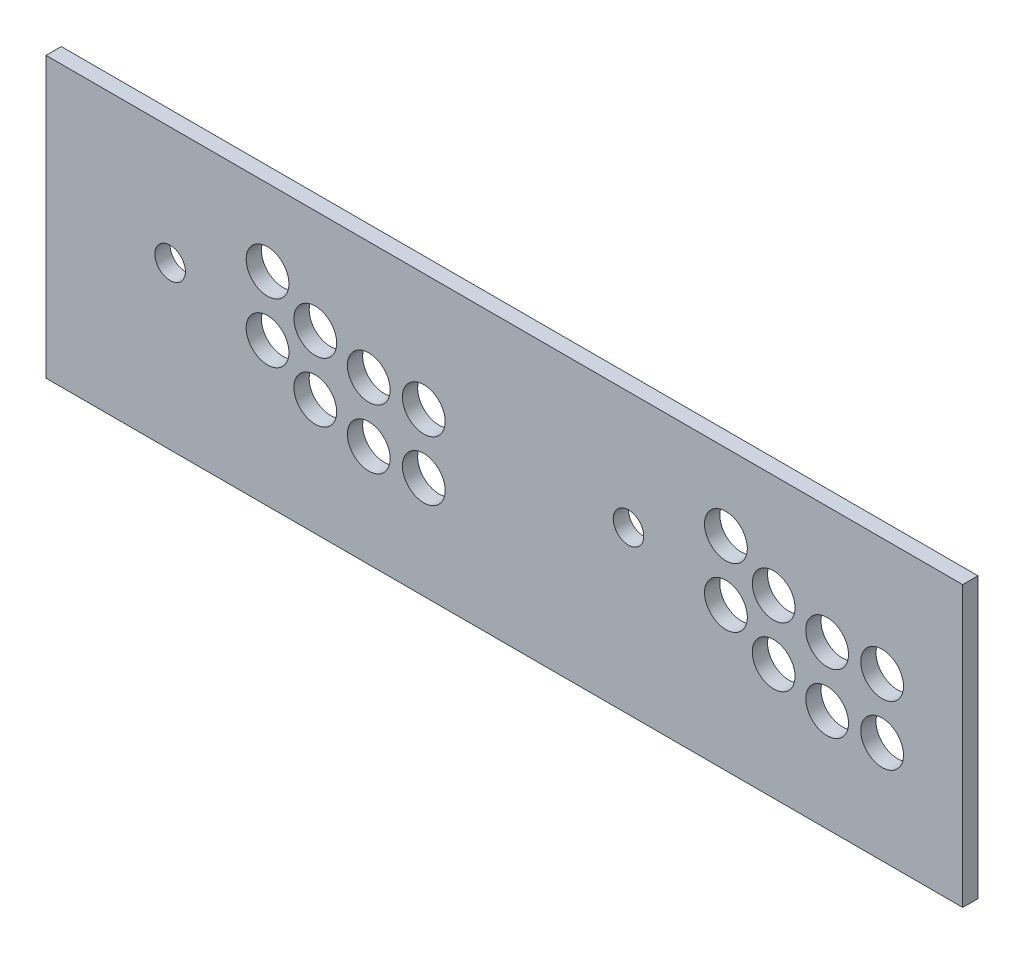
from build123d import *

# Parameters (mm, degrees)
ESQUISSE1_W                = 600
ESQUISSE1_H                = 183
BOSS_EXTRU_1_DEPTH         = 10
ESQUISSE3_R                = 14
ESQUISSE3_R_2              = 10
ENL_V_MAT_EXTRU_1_DEPTH    = 10
R_P_TITION_LIN_AIRE1_COUNT = 2
R_P_TITION_LIN_AIRE1_PITCH = 300


with BuildPart() as part:
    # Esquisse1 → Boss.-Extru.1 (new body)
    with BuildSketch(Plane.XY):
        with Locations((300, 91.5)):
            Rectangle(ESQUISSE1_W, ESQUISSE1_H)
    extrude(amount=BOSS_EXTRU_1_DEPTH)

    # Esquisse3 → Enlèv. mat.-Extru.1 (cut)
    with BuildSketch(Plane(origin=(0, 0, 0), x_dir=(-1, 0, 0), z_dir=(0, 0, -1))):
        with Locations((-247.25, 67)):
            Circle(ESQUISSE3_R)
        with Locations((-211.25, 67)):
            Circle(ESQUISSE3_R)
        with Locations((-81.25, 106)):
            Circle(ESQUISSE3_R_2)
        with Locations((-176.25, 76)):
            Circle(ESQUISSE3_R)
        with Locations((-145, 94)):
            Circle(ESQUISSE3_R)
        with Locations((-247.25, 106)):
            Circle(ESQUISSE3_R)
        with Locations((-211.25, 106)):
            Circle(ESQUISSE3_R)
        with Locations((-176.25, 115)):
            Circle(ESQUISSE3_R)
        with Locations((-145, 133)):
            Circle(ESQUISSE3_R)
    enl_v_mat_extru_1 = extrude(amount=-ENL_V_MAT_EXTRU_1_DEPTH, mode=Mode.SUBTRACT)

    # Répétition linéaire1: Enlèv. mat.-Extru.1 ×2
    with Locations(*[(i * R_P_TITION_LIN_AIRE1_PITCH, 0, 0) for i in range(1, R_P_TITION_LIN_AIRE1_COUNT)]):
        add(enl_v_mat_extru_1, mode=Mode.SUBTRACT)


solid = part.part
